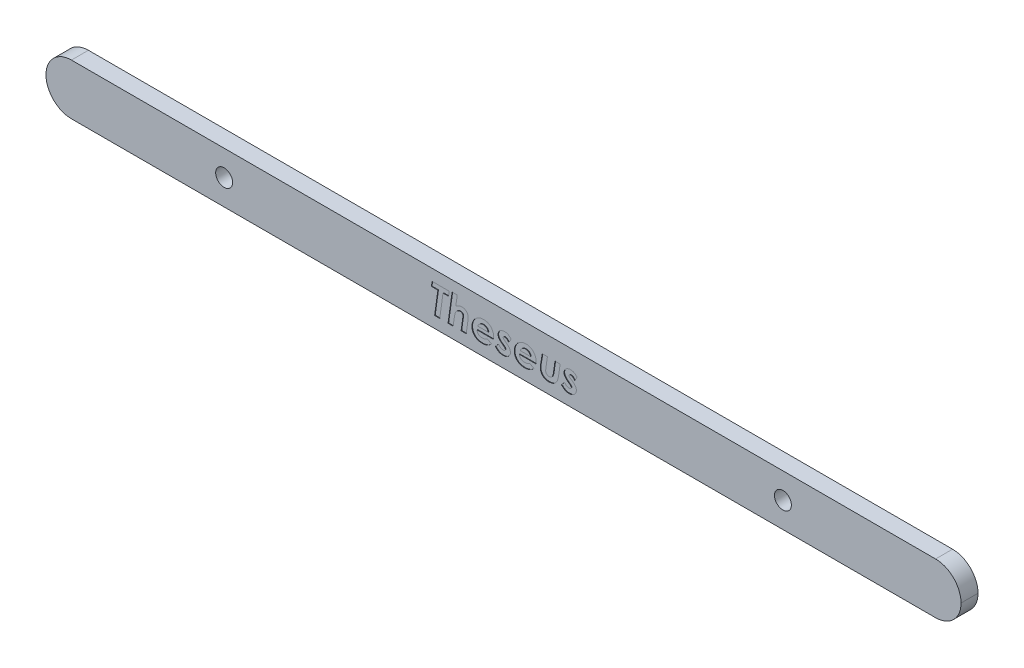
from build123d import *

# Parameters (mm, degrees)
SKETCH1_W           = 161.8
SKETCH1_H           = 9
SKETCH1_R           = 1.5
BOSS_EXTRUDE1_DEPTH = 1.5
CUT_EXTRUDE1_DEPTH  = 0.1
FILLET1_R           = 4.5


with BuildPart() as part:
    # Sketch1 → Boss-Extrude1 (new, symmetric)
    with BuildSketch(Plane.XY):
        Rectangle(SKETCH1_W, SKETCH1_H)
        with Locations((-49.4, 0)):
            Circle(SKETCH1_R, mode=Mode.SUBTRACT)
        with Locations(Location((49.4, 0, 0), (0, 0, 180))):
            Circle(SKETCH1_R, mode=Mode.SUBTRACT)
    extrude(amount=BOSS_EXTRUDE1_DEPTH, both=True)

    # Sketch2 → Cut-Extrude1 (cut)
    # profile 1 of 7: a face of its own
    with BuildSketch(Plane.XY.offset(1.5)):
        Polygon((-12.628205128, 2.5), (-9.615384615, 2.5), (-9.723557692, 1.666666667), (-10.697115385, 1.666666667), (-11.275040064, -2.5), (-12.17948718, -2.5), (-11.602564103, 1.666666667), (-12.743389423, 1.666666667), align=None)
    # profile 2 of 7: a face of its own
    with BuildSketch(Plane.XY.offset(1.5)):
        with BuildLine():
            Line((-9.088541667, 2.628205128), (-8.183092949, 2.628205128))
            Line((-8.183092949, 2.628205128), (-8.446514423, 0.751201923))
            add(Edge.make_bspline(
                [(-8.446514423, 0.751201923), (-8.402995696, 0.7882875), (-8.317719483, 0.860957769), (-8.18345573, 0.955723422), (-8.048340357, 1.036695979), (-7.912140097, 1.103901843), (-7.773185578, 1.153126248), (-7.634191592, 1.191323895), (-7.493406742, 1.214042888), (-7.398916851, 1.216648446), (-7.351762821, 1.217948718)],
                knots=[0, 0, 0, 0, 1.126950258, 2.208291845, 3.235685472, 4.230852531, 5.197119324, 6.137681051, 7.070632387, 8, 8, 8, 8], degree=3))
            add(Edge.make_bspline(
                [(-7.351762821, 1.217948718), (-7.312005012, 1.216836493), (-7.234278476, 1.214662094), (-7.120483764, 1.202075347), (-7.012666127, 1.178564049), (-6.909707989, 1.146900618), (-6.81285071, 1.104303858), (-6.720529532, 1.054519931), (-6.635255358, 0.993445134), (-6.555395375, 0.925083317), (-6.483967974, 0.848979103), (-6.419929711, 0.768860589), (-6.366785392, 0.682857537), (-6.322237062, 0.592492615), (-6.288101839, 0.496687943), (-6.264208438, 0.396268656), (-6.24998142, 0.291205672), (-6.248003466, 0.219728949), (-6.246995192, 0.183293269)],
                knots=[0, 0, 0, 0, 1.125569649, 2.200489218, 3.2347607, 4.245007566, 5.243919716, 6.225152204, 7.208384982, 8.206760563, 9.196105357, 10.158406127, 11.105034341, 12.051756892, 13.005294035, 13.977152713, 14.968841716, 16, 16, 16, 16], degree=3))
            add(Edge.make_bspline(
                [(-6.246995192, 0.183293269), (-6.248075636, 0.143886806), (-6.250467876, 0.056635911), (-6.260630433, -0.08746207), (-6.280756479, -0.256907861), (-6.296610509, -0.378624403), (-6.305088141, -0.443709936)],
                knots=[0, 0, 0, 0, 0.750743129, 1.6622403, 2.749928862, 4, 4, 4, 4], degree=3))
            Line((-6.305088141, -0.443709936), (-6.594551282, -2.5))
            Line((-6.594551282, -2.5), (-7.5, -2.5))
            Line((-7.5, -2.5), (-7.216546474, -0.488782051))
            add(Edge.make_bspline(
                [(-7.216546474, -0.488782051), (-7.21036365, -0.44306526), (-7.198824427, -0.3577424), (-7.185313233, -0.238918377), (-7.178174131, -0.138303355), (-7.176316781, -0.077464367), (-7.175480769, -0.050080128)],
                knots=[0, 0, 0, 0, 1.255630561, 2.343427635, 3.254360171, 4, 4, 4, 4], degree=3))
            add(Edge.make_bspline(
                [(-7.175480769, -0.050080128), (-7.176910709, -0.017221785), (-7.179653135, 0.045795971), (-7.203463178, 0.134857718), (-7.245823, 0.210871424), (-7.30308355, 0.274678827), (-7.376212823, 0.324080713), (-7.462822203, 0.360502353), (-7.563494658, 0.381041492), (-7.634788696, 0.383383788), (-7.672275641, 0.384615385)],
                knots=[0, 0, 0, 0, 1.050605419, 2.01491584, 2.918850053, 3.811536677, 4.733293049, 5.71961023, 6.800953799, 8, 8, 8, 8], degree=3))
            add(Edge.make_bspline(
                [(-7.672275641, 0.384615385), (-7.711192297, 0.383009431), (-7.790103129, 0.379753057), (-7.907027573, 0.348441657), (-8.024089985, 0.300830387), (-8.138326882, 0.23398525), (-8.24712194, 0.152116553), (-8.343891405, 0.053348036), (-8.425838049, -0.060935495), (-8.484183979, -0.168072267), (-8.525290285, -0.266307667), (-8.554899755, -0.355805147), (-8.583441626, -0.46029249), (-8.612537873, -0.579120998), (-8.640133911, -0.712882297), (-8.668375655, -0.861049383), (-8.695198044, -1.024057011), (-8.711484837, -1.137788815), (-8.719951923, -1.196915064)],
                knots=[0, 0, 0, 0, 0.892286547, 1.809278636, 2.762036141, 3.789377712, 4.840069328, 5.881314312, 6.952050478, 8.060490889, 8.675788013, 9.39606915, 10.224080956, 11.163409914, 12.205755774, 13.360913367, 14.628006524, 16, 16, 16, 16], degree=3))
            Line((-8.719951923, -1.196915064), (-8.90224359, -2.5))
            Line((-8.90224359, -2.5), (-9.807692308, -2.5))
            Line((-9.807692308, -2.5), (-9.088541667, 2.628205128))
        make_face()
    # profile 3 of 7: a face of its own
    with BuildSketch(Plane.XY.offset(1.5)):
        with BuildLine():
            Line((-2.892628205, -1.419270833), (-2.108373397, -1.821915064))
            add(Edge.make_bspline(
                [(-2.108373397, -1.821915064), (-2.154704024, -1.877348437), (-2.247828815, -1.988769794), (-2.415239399, -2.133179401), (-2.602540698, -2.261188383), (-2.81038722, -2.36943667), (-3.034851917, -2.45711626), (-3.273360747, -2.518144054), (-3.523292313, -2.55814223), (-3.694085606, -2.562091623), (-3.78104968, -2.564102564)],
                knots=[0, 0, 0, 0, 0.914244933, 1.837636877, 2.790537697, 3.784087733, 4.800790172, 5.83726639, 6.89878507, 8, 8, 8, 8], degree=3))
            add(Edge.make_bspline(
                [(-3.78104968, -2.564102564), (-3.84889558, -2.562949414), (-3.98096068, -2.560704754), (-4.173486882, -2.537673201), (-4.355424107, -2.50260413), (-4.525847674, -2.451031885), (-4.686209726, -2.387150615), (-4.834531887, -2.306795993), (-4.971779436, -2.211588059), (-5.097964946, -2.104114865), (-5.210090944, -1.983240372), (-5.308949087, -1.853172626), (-5.391347956, -1.712255264), (-5.460100853, -1.562896486), (-5.511746207, -1.402989112), (-5.550183442, -1.234502848), (-5.572034798, -1.055925868), (-5.575267681, -0.933885138), (-5.576923077, -0.871394231)],
                knots=[0, 0, 0, 0, 1.167516698, 2.272623801, 3.333371772, 4.353538571, 5.333382306, 6.300396664, 7.250661637, 8.204535574, 9.148031545, 10.083792083, 11.011414416, 11.952824574, 12.908912643, 13.898953575, 14.92416002, 16, 16, 16, 16], degree=3))
            add(Edge.make_bspline(
                [(-5.576923077, -0.871394231), (-5.575441666, -0.799503975), (-5.572528114, -0.658114494), (-5.542082896, -0.450929636), (-5.495184884, -0.25194696), (-5.429452285, -0.061278878), (-5.342756332, 0.120222198), (-5.239964763, 0.294660439), (-5.115600535, 0.458908663), (-4.975060764, 0.613386384), (-4.82144189, 0.754112078), (-4.658559173, 0.878499808), (-4.48696187, 0.983365377), (-4.307918068, 1.069635675), (-4.120582945, 1.13663509), (-3.925387733, 1.182920344), (-3.722585197, 1.213496488), (-3.584514483, 1.216452428), (-3.514623397, 1.217948718)],
                knots=[0, 0, 0, 0, 1.05529311, 2.075487762, 3.068699193, 4.055083011, 5.031283693, 6.018666653, 7.023995929, 8.051577733, 9.082465902, 10.079966066, 11.057287041, 12.031169187, 12.994424047, 13.973330935, 14.974104677, 16, 16, 16, 16], degree=3))
            add(Edge.make_bspline(
                [(-3.514623397, 1.217948718), (-3.472209123, 1.217007356), (-3.388601347, 1.215151727), (-3.264715498, 1.205577263), (-3.144834021, 1.18689755), (-3.028102011, 1.163631962), (-2.915484586, 1.131076977), (-2.806365067, 1.091674886), (-2.699617151, 1.047318936), (-2.59788362, 0.993461177), (-2.499326126, 0.935233182), (-2.407116937, 0.86806363), (-2.31889111, 0.796501348), (-2.236187631, 0.718085454), (-2.160277306, 0.632385636), (-2.088606992, 0.540996598), (-2.022878425, 0.442612239), (-1.961765873, 0.339211148), (-1.908267688, 0.230675874), (-1.859595541, 0.120563622), (-1.821060652, 0.00691664), (-1.787071385, -0.108066095), (-1.763118828, -0.22653026), (-1.742897539, -0.346620675), (-1.73369332, -0.469275083), (-1.731748281, -0.551540005), (-1.730769231, -0.592948718)],
                knots=[0, 0, 0, 0, 1.072343926, 2.113823519, 3.137889586, 4.13760148, 5.120645553, 6.097657508, 7.069516392, 8.039614793, 9.005002879, 9.960565349, 10.920144366, 11.87525951, 12.837543921, 13.811635494, 14.808779264, 15.826321551, 16.845367656, 17.865985152, 18.866871901, 19.876579391, 20.894541571, 21.919893521, 22.952961626, 24, 24, 24, 24], degree=3))
            add(Edge.make_bspline(
                [(-1.730769231, -0.592948718), (-1.731197345, -0.62033439), (-1.732085827, -0.677169038), (-1.738332332, -0.766092267), (-1.749497203, -0.861599069), (-1.759605745, -0.927513695), (-1.764823718, -0.961538462)],
                knots=[0, 0, 0, 0, 0.886860648, 1.840539587, 2.885298471, 4, 4, 4, 4], degree=3))
            Line((-1.764823718, -0.961538462), (-4.67948718, -0.961538462))
            add(Edge.make_bspline(
                [(-4.67948718, -0.961538462), (-4.677574628, -0.990288475), (-4.67384368, -1.04637312), (-4.661248165, -1.128102851), (-4.639830493, -1.204847297), (-4.611577196, -1.277128362), (-4.577478731, -1.345774486), (-4.536522488, -1.410474241), (-4.486940434, -1.46924642), (-4.431562259, -1.52392849), (-4.369834941, -1.572773278), (-4.302028065, -1.614787864), (-4.229346821, -1.651761688), (-4.149992693, -1.679923947), (-4.06575284, -1.703442347), (-3.975807613, -1.718909333), (-3.880461866, -1.729474607), (-3.814801656, -1.730329686), (-3.78104968, -1.730769231)],
                knots=[0, 0, 0, 0, 1.040300458, 2.029386266, 2.980027991, 3.911437883, 4.828060054, 5.744444316, 6.66911896, 7.598419554, 8.551199615, 9.504589747, 10.47513087, 11.489753162, 12.539789264, 13.630032591, 14.781741895, 16, 16, 16, 16], degree=3))
            add(Edge.make_bspline(
                [(-3.78104968, -1.730769231), (-3.739953317, -1.72970156), (-3.658524314, -1.72758606), (-3.538017341, -1.713907415), (-3.421302294, -1.688177417), (-3.308078502, -1.6541973), (-3.197908145, -1.611483316), (-3.092813679, -1.556271919), (-2.989687349, -1.493590211), (-2.925256829, -1.444254971), (-2.892628205, -1.419270833)],
                knots=[0, 0, 0, 0, 1.027214308, 2.035339218, 3.025519259, 4.010199041, 4.987959988, 5.973205312, 6.973599434, 8, 8, 8, 8], degree=3))
        make_face()
        with BuildLine():
            add(Edge.make_bspline(
                [(-2.692307692, -0.320512821), (-2.71011779, -0.265483301), (-2.744411417, -0.159523087), (-2.819217492, -0.015678251), (-2.910532934, 0.107225043), (-3.01847005, 0.208304681), (-3.140962099, 0.287025151), (-3.275674848, 0.343960258), (-3.422702252, 0.379032421), (-3.52510845, 0.382720476), (-3.577724359, 0.384615385)],
                knots=[0, 0, 0, 0, 1.131480038, 2.178682812, 3.159669316, 4.117470342, 5.058967564, 5.99670948, 6.970717055, 8, 8, 8, 8], degree=3))
            add(Edge.make_bspline(
                [(-3.577724359, 0.384615385), (-3.630362511, 0.382766807), (-3.734190849, 0.379120503), (-3.8850425, 0.341968378), (-4.02875023, 0.28474051), (-4.162205782, 0.202874565), (-4.285729914, 0.101925427), (-4.391752671, -0.021394177), (-4.485190074, -0.161728222), (-4.530824749, -0.266596829), (-4.554286859, -0.320512821)],
                knots=[0, 0, 0, 0, 0.983432494, 1.939812791, 2.890131691, 3.868528921, 4.858194814, 5.863362488, 6.901492691, 8, 8, 8, 8], degree=3))
            Line((-4.554286859, -0.320512821), (-2.692307692, -0.320512821))
        make_face(mode=Mode.SUBTRACT)
    # profile 4 of 7: a face of its own
    with BuildSketch(Plane.XY.offset(1.5)):
        with BuildLine():
            Line((1.333133013, 0.611979167), (0.907451923, -0.075120192))
            add(Edge.make_bspline(
                [(0.907451923, -0.075120192), (0.88034917, -0.037921711), (0.828174415, 0.033688051), (0.742963542, 0.129617116), (0.654844682, 0.209156374), (0.565061718, 0.272802223), (0.476407501, 0.321667215), (0.390343308, 0.357773213), (0.306628615, 0.380188963), (0.25119082, 0.383171729), (0.224358974, 0.384615385)],
                knots=[0, 0, 0, 0, 1.293875212, 2.490803217, 3.601185646, 4.625026071, 5.578970932, 6.442087991, 7.245971894, 8, 8, 8, 8], degree=3))
            add(Edge.make_bspline(
                [(0.224358974, 0.384615385), (0.204937314, 0.383862986), (0.167036218, 0.38239469), (0.11228909, 0.370444815), (0.062473379, 0.349084514), (0.019377216, 0.320223432), (-0.017357694, 0.287716738), (-0.043428148, 0.251319673), (-0.06161024, 0.212925233), (-0.063271789, 0.185825505), (-0.064102564, 0.172275641)],
                knots=[0, 0, 0, 0, 1.182476273, 2.30758579, 3.391877461, 4.463697876, 5.456992938, 6.360200449, 7.180100224, 8, 8, 8, 8], degree=3))
            add(Edge.make_bspline(
                [(-0.064102564, 0.172275641), (-0.063416163, 0.15912537), (-0.062010006, 0.132185833), (-0.047098612, 0.092782636), (-0.027966913, 0.051987511), (-0.008259884, 0.027681961), (0.002003205, 0.015024038)],
                knots=[0, 0, 0, 0, 0.903144459, 1.85017425, 2.880406844, 4, 4, 4, 4], degree=3))
            add(Edge.make_bspline(
                [(0.002003205, 0.015024038), (0.008552908, 0.007554169), (0.023519895, -0.009515526), (0.052350328, -0.035199344), (0.088385655, -0.066263491), (0.132238248, -0.102312519), (0.184682942, -0.141821567), (0.243603162, -0.187692613), (0.312079818, -0.236171153), (0.360250661, -0.270424198), (0.385616987, -0.288461538)],
                knots=[0, 0, 0, 0, 0.486262068, 1.111176692, 1.888157049, 2.817936484, 3.890888726, 5.104451828, 6.475230771, 8, 8, 8, 8], degree=3))
            add(Edge.make_bspline(
                [(0.385616987, -0.288461538), (0.426520367, -0.31760578), (0.505439626, -0.373836878), (0.616754162, -0.458934885), (0.716644567, -0.541137754), (0.806856074, -0.61891401), (0.884370954, -0.695496386), (0.953336786, -0.766743992), (1.009661826, -0.836543705), (1.070846147, -0.923374782), (1.128981876, -1.034516877), (1.181451204, -1.171692326), (1.212208194, -1.31541708), (1.216025615, -1.413119955), (1.217948718, -1.462339744)],
                knots=[0, 0, 0, 0, 1.202285104, 2.319697097, 3.353301761, 4.299159753, 5.169575473, 5.96111865, 6.671375532, 7.314364668, 8.50149111, 9.6623909, 10.822382393, 12, 12, 12, 12], degree=3))
            add(Edge.make_bspline(
                [(1.217948718, -1.462339744), (1.217074819, -1.495128811), (1.21532539, -1.560768184), (1.198340781, -1.65805454), (1.172479505, -1.75422117), (1.134704317, -1.848535983), (1.08753293, -1.942295169), (1.029145518, -2.03426401), (0.960293397, -2.124857678), (0.882466128, -2.213495699), (0.793504627, -2.295448526), (0.695276658, -2.368277306), (0.586456841, -2.428359595), (0.469004154, -2.479159282), (0.340899435, -2.51617668), (0.204403509, -2.544804834), (0.058113526, -2.560329549), (-0.042368166, -2.562819425), (-0.094150641, -2.564102564)],
                knots=[0, 0, 0, 0, 0.823882478, 1.649303646, 2.476260642, 3.324427264, 4.199309487, 5.112434692, 6.059514339, 7.058678777, 8.074738792, 9.095747378, 10.125726673, 11.194005657, 12.30701197, 13.472823075, 14.697638618, 16, 16, 16, 16], degree=3))
            add(Edge.make_bspline(
                [(-0.094150641, -2.564102564), (-0.154340707, -2.562397838), (-0.272677407, -2.55904626), (-0.445968231, -2.531810757), (-0.610528139, -2.484792526), (-0.742435993, -2.43222377), (-0.845379235, -2.37910535), (-0.923510043, -2.329976835), (-1.004927216, -2.275280597), (-1.087673243, -2.21179086), (-1.173216746, -2.141330969), (-1.260884019, -2.063632817), (-1.350487296, -1.977838152), (-1.409762476, -1.917240865), (-1.440304487, -1.886017628)],
                knots=[0, 0, 0, 0, 1.3917013, 2.736154834, 4.044007326, 5.343168153, 6.013207005, 6.720436798, 7.476485983, 8.281134576, 9.131434638, 10.039487272, 10.989830126, 12, 12, 12, 12], degree=3))
            Line((-1.440304487, -1.886017628), (-0.888421474, -1.251001603))
            add(Edge.make_bspline(
                [(-0.888421474, -1.251001603), (-0.857273524, -1.2888922), (-0.796881371, -1.36235754), (-0.699903894, -1.460845883), (-0.600261528, -1.543805412), (-0.49820587, -1.611666618), (-0.394349554, -1.665486139), (-0.287365969, -1.702596725), (-0.17874873, -1.727263883), (-0.104966665, -1.729601486), (-0.068108974, -1.730769231)],
                knots=[0, 0, 0, 0, 1.194983961, 2.316931099, 3.362897671, 4.349081709, 5.298844883, 6.204687641, 7.103155112, 8, 8, 8, 8], degree=3))
            add(Edge.make_bspline(
                [(-0.068108974, -1.730769231), (-0.039968803, -1.730015613), (0.013816506, -1.728575196), (0.089818632, -1.712037225), (0.157487625, -1.686420051), (0.21451553, -1.649090691), (0.260624325, -1.604965887), (0.29608855, -1.557122517), (0.316226844, -1.503200912), (0.319066984, -1.466168093), (0.32051282, -1.447315705)],
                knots=[0, 0, 0, 0, 1.262863261, 2.413755393, 3.478337955, 4.49818724, 5.453495978, 6.336264993, 7.153038342, 8, 8, 8, 8], degree=3))
            add(Edge.make_bspline(
                [(0.32051282, -1.447315705), (0.319513206, -1.431832881), (0.317447769, -1.399841765), (0.30083033, -1.352391495), (0.277035446, -1.303506536), (0.246775866, -1.263609325), (0.215831607, -1.228534394), (0.183066863, -1.197387529), (0.141986739, -1.161695971), (0.092859867, -1.12066478), (0.03556091, -1.074416619), (-0.030324897, -1.023339389), (-0.10569446, -0.968686144), (-0.158581289, -0.930479806), (-0.186298077, -0.910456731)],
                knots=[0, 0, 0, 0, 0.730705261, 1.509807026, 2.357288366, 3.29541125, 3.865889586, 4.569470673, 5.431105645, 6.440057403, 7.596752151, 8.913931468, 10.38266143, 12, 12, 12, 12], degree=3))
            add(Edge.make_bspline(
                [(-0.186298077, -0.910456731), (-0.218780754, -0.886885677), (-0.281908122, -0.841077305), (-0.371670033, -0.772591235), (-0.452965821, -0.705824133), (-0.527534665, -0.64323194), (-0.593379539, -0.58207143), (-0.651984562, -0.524045686), (-0.70221874, -0.468216448), (-0.731375143, -0.430523075), (-0.745192308, -0.412660256)],
                knots=[0, 0, 0, 0, 1.282428707, 2.492293047, 3.606974981, 4.643787634, 5.602579517, 6.477648517, 7.278560515, 8, 8, 8, 8], degree=3))
            add(Edge.make_bspline(
                [(-0.745192308, -0.412660256), (-0.778104845, -0.364476429), (-0.842254912, -0.270560979), (-0.910971713, -0.117443575), (-0.952984599, 0.040163685), (-0.958689928, 0.146986466), (-0.961538462, 0.200320513)],
                knots=[0, 0, 0, 0, 1.057832104, 2.061828311, 3.032317477, 4, 4, 4, 4], degree=3))
            add(Edge.make_bspline(
                [(-0.961538462, 0.200320513), (-0.960800726, 0.237124536), (-0.959350355, 0.309480435), (-0.941289961, 0.414790991), (-0.914697154, 0.515135706), (-0.875949569, 0.60959719), (-0.827993421, 0.69999058), (-0.766984827, 0.783872431), (-0.696843399, 0.863721369), (-0.61562964, 0.936283283), (-0.527023493, 1.001081158), (-0.434939776, 1.060539528), (-0.336912798, 1.108005569), (-0.235965446, 1.148355422), (-0.131059599, 1.17971011), (-0.022048471, 1.201292188), (0.090732426, 1.216237907), (0.167552001, 1.217374814), (0.206330128, 1.217948718)],
                knots=[0, 0, 0, 0, 1.021630065, 2.008502182, 2.960568009, 3.90126412, 4.839440403, 5.797185411, 6.776483436, 7.788164727, 8.816178467, 9.825218622, 10.829341502, 11.837229321, 12.844091735, 13.866690309, 14.923116238, 16, 16, 16, 16], degree=3))
            add(Edge.make_bspline(
                [(0.206330128, 1.217948718), (0.260864234, 1.215910769), (0.369698834, 1.211843601), (0.530882646, 1.182435484), (0.687214558, 1.13129747), (0.838202757, 1.062313503), (0.981532346, 0.97584661), (1.112204964, 0.870231668), (1.232057141, 0.750074609), (1.299209431, 0.658327439), (1.333133013, 0.611979167)],
                knots=[0, 0, 0, 0, 0.983198209, 1.962184592, 2.942724805, 3.942248462, 4.950006518, 5.952318655, 6.965564907, 8, 8, 8, 8], degree=3))
        make_face()
    # profile 5 of 7: a face of its own
    with BuildSketch(Plane.XY.offset(1.5)):
        with BuildLine():
            Line((4.607371795, -1.419270833), (5.391626603, -1.821915064))
            add(Edge.make_bspline(
                [(5.391626603, -1.821915064), (5.345295976, -1.877348437), (5.252171185, -1.988769794), (5.084760601, -2.133179401), (4.897459302, -2.261188383), (4.68961278, -2.36943667), (4.465148083, -2.45711626), (4.226639253, -2.518144054), (3.976707687, -2.55814223), (3.805914394, -2.562091623), (3.718950321, -2.564102564)],
                knots=[0, 0, 0, 0, 0.914244933, 1.837636877, 2.790537697, 3.784087733, 4.800790172, 5.83726639, 6.89878507, 8, 8, 8, 8], degree=3))
            add(Edge.make_bspline(
                [(3.718950321, -2.564102564), (3.65110442, -2.562949414), (3.51903932, -2.560704754), (3.326513118, -2.537673201), (3.144575893, -2.50260413), (2.974152326, -2.451031885), (2.813790274, -2.387150615), (2.665468113, -2.306795993), (2.528220564, -2.211588059), (2.402035054, -2.104114865), (2.289909056, -1.983240372), (2.191050913, -1.853172626), (2.108652044, -1.712255264), (2.039899147, -1.562896486), (1.988253793, -1.402989112), (1.949816558, -1.234502848), (1.927965202, -1.055925868), (1.924732319, -0.933885138), (1.923076923, -0.871394231)],
                knots=[0, 0, 0, 0, 1.167516698, 2.272623801, 3.333371772, 4.353538571, 5.333382306, 6.300396664, 7.250661637, 8.204535574, 9.148031545, 10.083792083, 11.011414416, 11.952824574, 12.908912643, 13.898953575, 14.92416002, 16, 16, 16, 16], degree=3))
            add(Edge.make_bspline(
                [(1.923076923, -0.871394231), (1.924558334, -0.799503975), (1.927471886, -0.658114494), (1.957917104, -0.450929636), (2.004815116, -0.25194696), (2.070547715, -0.061278878), (2.157243668, 0.120222198), (2.260035237, 0.294660439), (2.384399466, 0.458908663), (2.524939236, 0.613386384), (2.67855811, 0.754112078), (2.841440827, 0.878499808), (3.01303813, 0.983365377), (3.192081932, 1.069635675), (3.379417055, 1.13663509), (3.574612267, 1.182920344), (3.777414803, 1.213496488), (3.915485517, 1.216452428), (3.985376603, 1.217948718)],
                knots=[0, 0, 0, 0, 1.05529311, 2.075487762, 3.068699193, 4.055083011, 5.031283693, 6.018666653, 7.023995929, 8.051577733, 9.082465902, 10.079966066, 11.057287041, 12.031169187, 12.994424047, 13.973330935, 14.974104677, 16, 16, 16, 16], degree=3))
            add(Edge.make_bspline(
                [(3.985376603, 1.217948718), (4.027790877, 1.217007356), (4.111398653, 1.215151727), (4.235284502, 1.205577263), (4.355165979, 1.18689755), (4.471897989, 1.163631962), (4.584515414, 1.131076977), (4.693634933, 1.091674886), (4.800382849, 1.047318936), (4.90211638, 0.993461177), (5.000673874, 0.935233182), (5.092883063, 0.86806363), (5.18110889, 0.796501348), (5.263812369, 0.718085454), (5.339722694, 0.632385636), (5.411393008, 0.540996598), (5.477121575, 0.442612239), (5.538234127, 0.339211148), (5.591732312, 0.230675874), (5.640404459, 0.120563622), (5.678939348, 0.00691664), (5.712928615, -0.108066095), (5.736881172, -0.22653026), (5.757102461, -0.346620675), (5.76630668, -0.469275083), (5.768251719, -0.551540005), (5.769230769, -0.592948718)],
                knots=[0, 0, 0, 0, 1.072343926, 2.113823519, 3.137889586, 4.13760148, 5.120645553, 6.097657508, 7.069516392, 8.039614793, 9.005002879, 9.960565349, 10.920144366, 11.87525951, 12.837543921, 13.811635494, 14.808779264, 15.826321551, 16.845367656, 17.865985152, 18.866871901, 19.876579391, 20.894541571, 21.919893521, 22.952961626, 24, 24, 24, 24], degree=3))
            add(Edge.make_bspline(
                [(5.769230769, -0.592948718), (5.768802655, -0.62033439), (5.767914173, -0.677169038), (5.761667668, -0.766092267), (5.750502797, -0.861599069), (5.740394255, -0.927513695), (5.735176282, -0.961538462)],
                knots=[0, 0, 0, 0, 0.886860648, 1.840539587, 2.885298471, 4, 4, 4, 4], degree=3))
            Line((5.735176282, -0.961538462), (2.820512821, -0.961538462))
            add(Edge.make_bspline(
                [(2.820512821, -0.961538462), (2.822425372, -0.990288475), (2.82615632, -1.04637312), (2.838751835, -1.128102851), (2.860169507, -1.204847297), (2.888422804, -1.277128362), (2.922521269, -1.345774486), (2.963477512, -1.410474241), (3.013059566, -1.46924642), (3.068437741, -1.52392849), (3.130165059, -1.572773278), (3.197971935, -1.614787864), (3.270653179, -1.651761688), (3.350007307, -1.679923947), (3.43424716, -1.703442347), (3.524192387, -1.718909333), (3.619538134, -1.729474607), (3.685198344, -1.730329686), (3.718950321, -1.730769231)],
                knots=[0, 0, 0, 0, 1.040300458, 2.029386266, 2.980027991, 3.911437883, 4.828060054, 5.744444316, 6.66911896, 7.598419554, 8.551199615, 9.504589747, 10.47513087, 11.489753162, 12.539789264, 13.630032591, 14.781741895, 16, 16, 16, 16], degree=3))
            add(Edge.make_bspline(
                [(3.718950321, -1.730769231), (3.760046683, -1.72970156), (3.841475686, -1.72758606), (3.961982659, -1.713907415), (4.078697706, -1.688177417), (4.191921498, -1.6541973), (4.302091855, -1.611483316), (4.407186321, -1.556271919), (4.510312651, -1.493590211), (4.574743171, -1.444254971), (4.607371795, -1.419270833)],
                knots=[0, 0, 0, 0, 1.027214308, 2.035339218, 3.025519259, 4.010199041, 4.987959988, 5.973205312, 6.973599434, 8, 8, 8, 8], degree=3))
        make_face()
        with BuildLine():
            add(Edge.make_bspline(
                [(4.807692308, -0.320512821), (4.78988221, -0.265483301), (4.755588583, -0.159523087), (4.680782508, -0.015678251), (4.589467066, 0.107225043), (4.48152995, 0.208304681), (4.359037901, 0.287025151), (4.224325152, 0.343960258), (4.077297748, 0.379032421), (3.97489155, 0.382720476), (3.922275641, 0.384615385)],
                knots=[0, 0, 0, 0, 1.131480038, 2.178682812, 3.159669316, 4.117470342, 5.058967564, 5.99670948, 6.970717055, 8, 8, 8, 8], degree=3))
            add(Edge.make_bspline(
                [(3.922275641, 0.384615385), (3.869637489, 0.382766807), (3.765809151, 0.379120503), (3.6149575, 0.341968378), (3.47124977, 0.28474051), (3.337794218, 0.202874565), (3.214270086, 0.101925427), (3.108247329, -0.021394177), (3.014809926, -0.161728222), (2.969175251, -0.266596829), (2.945713141, -0.320512821)],
                knots=[0, 0, 0, 0, 0.983432494, 1.939812791, 2.890131691, 3.868528921, 4.858194814, 5.863362488, 6.901492691, 8, 8, 8, 8], degree=3))
            Line((2.945713141, -0.320512821), (4.807692308, -0.320512821))
        make_face(mode=Mode.SUBTRACT)
    # profile 6 of 7: a face of its own
    with BuildSketch(Plane.XY.offset(1.5)):
        with BuildLine():
            Line((6.857972756, 1.153846154), (7.763421474, 1.153846154))
            Line((7.763421474, 1.153846154), (7.496995192, -0.701121795))
            add(Edge.make_bspline(
                [(7.496995192, -0.701121795), (7.490812656, -0.749176833), (7.479276056, -0.838847437), (7.465764488, -0.963682217), (7.458595313, -1.069632252), (7.456760258, -1.13380714), (7.455929487, -1.162860577)],
                knots=[0, 0, 0, 0, 1.253526504, 2.339077935, 3.248062684, 4, 4, 4, 4], degree=3))
            add(Edge.make_bspline(
                [(7.455929487, -1.162860577), (7.457541955, -1.201520585), (7.460701112, -1.277263483), (7.494811454, -1.384890603), (7.546491068, -1.484022937), (7.61978686, -1.570134938), (7.709116871, -1.642231489), (7.813456392, -1.693575135), (7.92978304, -1.725890236), (8.011597702, -1.729106699), (8.053886218, -1.730769231)],
                knots=[0, 0, 0, 0, 1.002835694, 1.964761131, 2.909147679, 3.895784594, 4.884866332, 5.875587295, 6.90192956, 8, 8, 8, 8], degree=3))
            add(Edge.make_bspline(
                [(8.053886218, -1.730769231), (8.081627645, -1.730295765), (8.135635556, -1.729374006), (8.214172796, -1.719236082), (8.287561696, -1.702137111), (8.356051441, -1.679107625), (8.419831494, -1.650113035), (8.478457062, -1.613807723), (8.531475405, -1.570276093), (8.581503461, -1.520242088), (8.625637008, -1.458236618), (8.667948354, -1.385102894), (8.705280423, -1.297589481), (8.741703904, -1.19754573), (8.772837025, -1.083088963), (8.801918652, -0.955451396), (8.827770256, -0.814398052), (8.841835885, -0.715533047), (8.849158654, -0.6640625)],
                knots=[0, 0, 0, 0, 0.892108868, 1.736786517, 2.541881516, 3.312938247, 4.057891121, 4.791136306, 5.524224126, 6.261001152, 7.060198994, 7.964829526, 8.974738879, 10.116351085, 11.388184609, 12.787440625, 14.327495265, 16, 16, 16, 16], degree=3))
            Line((8.849158654, -0.6640625), (9.108573718, 1.153846154))
            Line((9.108573718, 1.153846154), (10.015024038, 1.153846154))
            Line((10.015024038, 1.153846154), (9.735576923, -0.802283654))
            add(Edge.make_bspline(
                [(9.735576923, -0.802283654), (9.72760999, -0.855430478), (9.712080813, -0.959024478), (9.68305731, -1.109403812), (9.649675884, -1.250551363), (9.614702884, -1.38309263), (9.572786681, -1.505297357), (9.529570197, -1.619294862), (9.48002152, -1.723212538), (9.411846949, -1.849197214), (9.313362783, -1.99024851), (9.178037316, -2.140769457), (9.023946908, -2.269636506), (8.852131528, -2.376235671), (8.664204595, -2.461526681), (8.459459529, -2.520777746), (8.239186888, -2.557795858), (8.087092258, -2.561959614), (8.008814103, -2.564102564)],
                knots=[0, 0, 0, 0, 0.938282912, 1.828904783, 2.673080473, 3.47068305, 4.220973376, 4.927886656, 5.59807994, 6.229421123, 7.427669869, 8.591533972, 9.754419504, 10.92230609, 12.112044702, 13.346047806, 14.63409719, 16, 16, 16, 16], degree=3))
            add(Edge.make_bspline(
                [(8.008814103, -2.564102564), (7.953337877, -2.563020966), (7.845083927, -2.56091038), (7.686978663, -2.542345659), (7.537639105, -2.513032837), (7.3974151, -2.470241032), (7.265002872, -2.417584935), (7.142028208, -2.351242459), (7.027224511, -2.273431612), (6.922911026, -2.183555038), (6.82879094, -2.08442307), (6.746046973, -1.978036894), (6.67645524, -1.864159532), (6.620224833, -1.743022173), (6.576224229, -1.615421505), (6.543818523, -1.481032296), (6.524521975, -1.339373983), (6.522477245, -1.242381419), (6.521434295, -1.192908654)],
                knots=[0, 0, 0, 0, 1.168632583, 2.280420012, 3.349725486, 4.371307417, 5.365511249, 6.347568045, 7.309587773, 8.282530155, 9.242979364, 10.185822766, 11.117310968, 12.048958566, 12.994554036, 13.956959565, 14.957911239, 16, 16, 16, 16], degree=3))
            add(Edge.make_bspline(
                [(6.521434295, -1.192908654), (6.522012333, -1.160522224), (6.523204496, -1.09372747), (6.526829259, -0.990142005), (6.53533726, -0.879975771), (6.546419219, -0.762782091), (6.560018953, -0.638790922), (6.57900377, -0.508453261), (6.598110405, -0.371315371), (6.614309503, -0.278068859), (6.622596154, -0.23036859)],
                knots=[0, 0, 0, 0, 0.80233306, 1.654755999, 2.566827454, 3.538651181, 4.570611162, 5.655930814, 6.800891005, 8, 8, 8, 8], degree=3))
            Line((6.622596154, -0.23036859), (6.857972756, 1.153846154))
        make_face()
    # profile 7 of 7: a face of its own
    with BuildSketch(Plane.XY.offset(1.5)):
        with BuildLine():
            Line((12.999799679, 0.611979167), (12.57411859, -0.075120192))
            add(Edge.make_bspline(
                [(12.57411859, -0.075120192), (12.547015837, -0.037921711), (12.494841081, 0.033688051), (12.409630209, 0.129617116), (12.321511349, 0.209156374), (12.231728385, 0.272802223), (12.143074168, 0.321667215), (12.057009974, 0.357773213), (11.973295281, 0.380188963), (11.917857487, 0.383171729), (11.891025641, 0.384615385)],
                knots=[0, 0, 0, 0, 1.293875212, 2.490803217, 3.601185646, 4.625026071, 5.578970932, 6.442087991, 7.245971894, 8, 8, 8, 8], degree=3))
            add(Edge.make_bspline(
                [(11.891025641, 0.384615385), (11.871603981, 0.383862986), (11.833702885, 0.38239469), (11.778955756, 0.370444815), (11.729140045, 0.349084514), (11.686043883, 0.320223432), (11.649308973, 0.287716738), (11.623238519, 0.251319673), (11.605056427, 0.212925233), (11.603394877, 0.185825505), (11.602564103, 0.172275641)],
                knots=[0, 0, 0, 0, 1.182476273, 2.30758579, 3.391877461, 4.463697876, 5.456992938, 6.360200449, 7.180100224, 8, 8, 8, 8], degree=3))
            add(Edge.make_bspline(
                [(11.602564103, 0.172275641), (11.603250504, 0.15912537), (11.604656661, 0.132185833), (11.619568055, 0.092782636), (11.638699754, 0.051987511), (11.658406782, 0.027681961), (11.668669872, 0.015024038)],
                knots=[0, 0, 0, 0, 0.903144459, 1.85017425, 2.880406844, 4, 4, 4, 4], degree=3))
            add(Edge.make_bspline(
                [(11.668669872, 0.015024038), (11.675219575, 0.007554169), (11.690186561, -0.009515526), (11.719016994, -0.035199344), (11.755052322, -0.066263491), (11.798904915, -0.102312519), (11.851349609, -0.141821567), (11.910269828, -0.187692613), (11.978746484, -0.236171153), (12.026917328, -0.270424198), (12.052283654, -0.288461538)],
                knots=[0, 0, 0, 0, 0.486262068, 1.111176692, 1.888157049, 2.817936484, 3.890888726, 5.104451828, 6.475230771, 8, 8, 8, 8], degree=3))
            add(Edge.make_bspline(
                [(12.052283654, -0.288461538), (12.093187033, -0.31760578), (12.172106293, -0.373836878), (12.283420828, -0.458934885), (12.383311233, -0.541137754), (12.473522741, -0.61891401), (12.55103762, -0.695496386), (12.620003452, -0.766743992), (12.676328492, -0.836543705), (12.737512814, -0.923374782), (12.795648543, -1.034516877), (12.848117871, -1.171692326), (12.878874861, -1.31541708), (12.882692282, -1.413119955), (12.884615385, -1.462339744)],
                knots=[0, 0, 0, 0, 1.202285104, 2.319697097, 3.353301761, 4.299159753, 5.169575473, 5.96111865, 6.671375532, 7.314364668, 8.50149111, 9.6623909, 10.822382393, 12, 12, 12, 12], degree=3))
            add(Edge.make_bspline(
                [(12.884615385, -1.462339744), (12.883741486, -1.495128811), (12.881992056, -1.560768184), (12.865007448, -1.65805454), (12.839146172, -1.75422117), (12.801370984, -1.848535983), (12.754199597, -1.942295169), (12.695812184, -2.03426401), (12.626960063, -2.124857678), (12.549132794, -2.213495699), (12.460171294, -2.295448526), (12.361943325, -2.368277306), (12.253123508, -2.428359595), (12.13567082, -2.479159282), (12.007566102, -2.51617668), (11.871070176, -2.544804834), (11.724780192, -2.560329549), (11.6242985, -2.562819425), (11.572516026, -2.564102564)],
                knots=[0, 0, 0, 0, 0.823882478, 1.649303646, 2.476260642, 3.324427264, 4.199309487, 5.112434692, 6.059514339, 7.058678777, 8.074738792, 9.095747378, 10.125726673, 11.194005657, 12.30701197, 13.472823075, 14.697638618, 16, 16, 16, 16], degree=3))
            add(Edge.make_bspline(
                [(11.572516026, -2.564102564), (11.51232596, -2.562397838), (11.39398926, -2.55904626), (11.220698436, -2.531810757), (11.056138528, -2.484792526), (10.924230673, -2.43222377), (10.821287431, -2.37910535), (10.743156623, -2.329976835), (10.661739451, -2.275280597), (10.578993424, -2.21179086), (10.493449921, -2.141330969), (10.405782647, -2.063632817), (10.316179371, -1.977838152), (10.25690419, -1.917240865), (10.226362179, -1.886017628)],
                knots=[0, 0, 0, 0, 1.3917013, 2.736154834, 4.044007326, 5.343168153, 6.013207005, 6.720436798, 7.476485983, 8.281134576, 9.131434638, 10.039487272, 10.989830126, 12, 12, 12, 12], degree=3))
            Line((10.226362179, -1.886017628), (10.778245192, -1.251001603))
            add(Edge.make_bspline(
                [(10.778245192, -1.251001603), (10.809393143, -1.2888922), (10.869785296, -1.36235754), (10.966762772, -1.460845883), (11.066405139, -1.543805412), (11.168460797, -1.611666618), (11.272317112, -1.665486139), (11.379300698, -1.702596725), (11.487917936, -1.727263883), (11.561700001, -1.729601486), (11.598557692, -1.730769231)],
                knots=[0, 0, 0, 0, 1.194983961, 2.316931099, 3.362897671, 4.349081709, 5.298844883, 6.204687641, 7.103155112, 8, 8, 8, 8], degree=3))
            add(Edge.make_bspline(
                [(11.598557692, -1.730769231), (11.626697864, -1.730015613), (11.680483173, -1.728575196), (11.756485299, -1.712037225), (11.824154291, -1.686420051), (11.881182197, -1.649090691), (11.927290991, -1.604965887), (11.962755216, -1.557122517), (11.982893511, -1.503200912), (11.98573365, -1.466168093), (11.987179487, -1.447315705)],
                knots=[0, 0, 0, 0, 1.262863261, 2.413755393, 3.478337955, 4.49818724, 5.453495978, 6.336264993, 7.153038342, 8, 8, 8, 8], degree=3))
            add(Edge.make_bspline(
                [(11.987179487, -1.447315705), (11.986179872, -1.431832881), (11.984114436, -1.399841765), (11.967496997, -1.352391495), (11.943702112, -1.303506536), (11.913442532, -1.263609325), (11.882498274, -1.228534394), (11.849733529, -1.197387529), (11.808653406, -1.161695971), (11.759526534, -1.12066478), (11.702227576, -1.074416619), (11.63634177, -1.023339389), (11.560972206, -0.968686144), (11.508085378, -0.930479806), (11.48036859, -0.910456731)],
                knots=[0, 0, 0, 0, 0.730705261, 1.509807026, 2.357288366, 3.29541125, 3.865889586, 4.569470673, 5.431105645, 6.440057403, 7.596752151, 8.913931468, 10.38266143, 12, 12, 12, 12], degree=3))
            add(Edge.make_bspline(
                [(11.48036859, -0.910456731), (11.447885913, -0.886885677), (11.384758545, -0.841077305), (11.294996634, -0.772591235), (11.213700846, -0.705824133), (11.139132002, -0.64323194), (11.073287127, -0.58207143), (11.014682105, -0.524045686), (10.964447927, -0.468216448), (10.935291523, -0.430523075), (10.921474359, -0.412660256)],
                knots=[0, 0, 0, 0, 1.282428707, 2.492293047, 3.606974981, 4.643787634, 5.602579517, 6.477648517, 7.278560515, 8, 8, 8, 8], degree=3))
            add(Edge.make_bspline(
                [(10.921474359, -0.412660256), (10.888561822, -0.364476429), (10.824411755, -0.270560979), (10.755694954, -0.117443575), (10.713682068, 0.040163685), (10.707976739, 0.146986466), (10.705128205, 0.200320513)],
                knots=[0, 0, 0, 0, 1.057832104, 2.061828311, 3.032317477, 4, 4, 4, 4], degree=3))
            add(Edge.make_bspline(
                [(10.705128205, 0.200320513), (10.70586594, 0.237124536), (10.707316312, 0.309480435), (10.725376706, 0.414790991), (10.751969512, 0.515135706), (10.790717098, 0.60959719), (10.838673246, 0.69999058), (10.899681839, 0.783872431), (10.969823268, 0.863721369), (11.051037027, 0.936283283), (11.139643174, 1.001081158), (11.23172689, 1.060539528), (11.329753868, 1.108005569), (11.430701221, 1.148355422), (11.535607068, 1.17971011), (11.644618195, 1.201292188), (11.757399093, 1.216237907), (11.834218668, 1.217374814), (11.872996795, 1.217948718)],
                knots=[0, 0, 0, 0, 1.021630065, 2.008502182, 2.960568009, 3.90126412, 4.839440403, 5.797185411, 6.776483436, 7.788164727, 8.816178467, 9.825218622, 10.829341502, 11.837229321, 12.844091735, 13.866690309, 14.923116238, 16, 16, 16, 16], degree=3))
            add(Edge.make_bspline(
                [(11.872996795, 1.217948718), (11.927530901, 1.215910769), (12.0363655, 1.211843601), (12.197549313, 1.182435484), (12.353881224, 1.13129747), (12.504869423, 1.062313503), (12.648199012, 0.97584661), (12.778871631, 0.870231668), (12.898723808, 0.750074609), (12.965876098, 0.658327439), (12.999799679, 0.611979167)],
                knots=[0, 0, 0, 0, 0.983198209, 1.962184592, 2.942724805, 3.942248462, 4.950006518, 5.952318655, 6.965564907, 8, 8, 8, 8], degree=3))
        make_face()
    extrude(amount=-CUT_EXTRUDE1_DEPTH, mode=Mode.SUBTRACT)

    # Fillet1
    fillet1_edges = [part.edges().sort_by_distance(p)[0] for p in [
        (80.9, -4.5, 0),
        (80.9, 4.5, 0),
        (-80.9, -4.5, 0),
        (-80.9, 4.5, 0),
    ]]
    fillet(fillet1_edges, radius=FILLET1_R - 0.0001)  # a hair under: the kernel refuses the full size


solid = part.part
